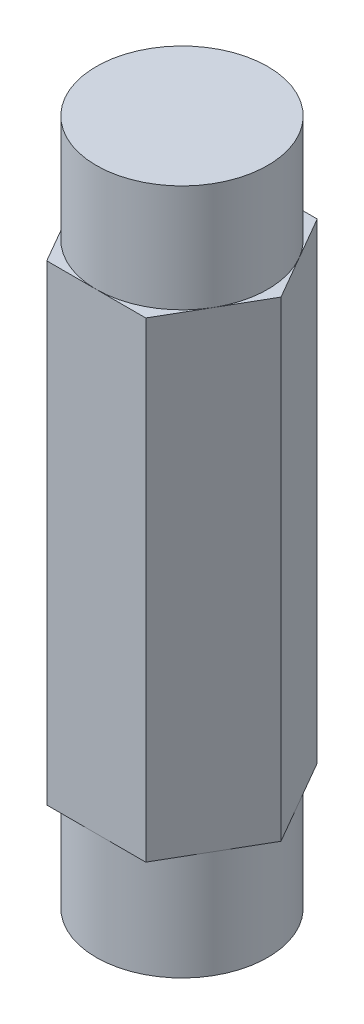
from build123d import *

# Parameters (mm, degrees)
BOSS_EXTRUDE1_DEPTH = 25.40508
SKETCH2_OUTSIDE_W   = 27.542
SKETCH2_OUTSIDE_H   = 25.578
SKETCH2_OUTSIDE_R   = 6.35
CUT_EXTRUDE1_DEPTH  = 7.9502


with BuildPart() as part:
    # Sketch1 → Boss-Extrude1 (new, symmetric)
    with BuildSketch(Plane(origin=(0, 0, 0), x_dir=(1, 0, 0), z_dir=(0, 1, 0))):
        Polygon((3.666174209, -6.35), (7.332348419, 0), (3.666174209, 6.35), (-3.666174209, 6.35), (-7.332348419, 0), (-3.666174209, -6.35), align=None)
    extrude(amount=BOSS_EXTRUDE1_DEPTH, both=True)

    # Sketch2 outside → Cut-Extrude1 (cut)
    with BuildSketch(Plane(origin=(0, 25.40508, 0), x_dir=(1, 0, 0), z_dir=(0, 1, 0))):
        Rectangle(SKETCH2_OUTSIDE_W, SKETCH2_OUTSIDE_H)
        Circle(SKETCH2_OUTSIDE_R, mode=Mode.SUBTRACT)
    cut_extrude1 = extrude(amount=-CUT_EXTRUDE1_DEPTH, mode=Mode.SUBTRACT)

    # Mirror1: Cut-Extrude1 across plane
    add(cut_extrude1.mirror(Plane.ZX), mode=Mode.SUBTRACT)


solid = part.part
